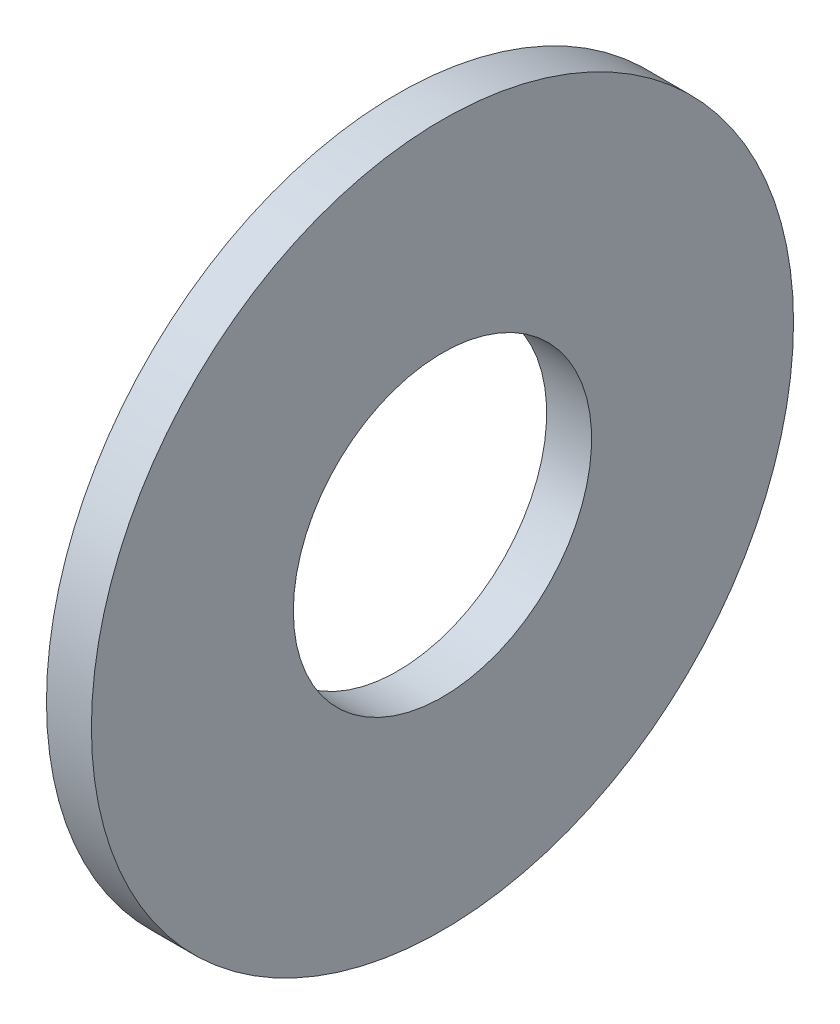
from build123d import *

# Parameters (mm, degrees)
SKETCH1_W = 4.064
SKETCH1_H = 18.2626


with BuildPart() as part:
    # Sketch1 → Base-Revolve (revolve)
    with BuildSketch(Plane.XY):
        with Locations((-2.032, 22.6187)):
            Rectangle(SKETCH1_W, SKETCH1_H)
    revolve(axis=Axis((-34.925, 0, 0), (1, 0, 0)))


solid = part.part
